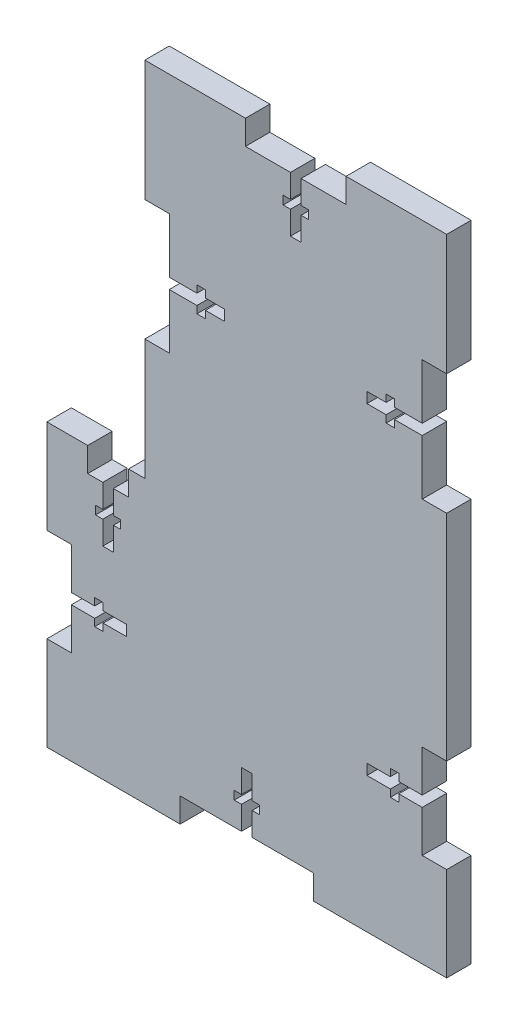
from build123d import *

# Parameters (mm, degrees)
SKETCH1_W           = 98.0948
SKETCH1_H           = 69.1388
BOSS_EXTRUDE1_DEPTH = 5.9944
SKETCH2_W           = 10.0076
SKETCH2_H           = 5.9944
CUT_EXTRUDE1_DEPTH  = 61.304425165
SKETCH3_W           = 5.9944
SKETCH3_H           = 23.046266666
CUT_EXTRUDE2_DEPTH  = 61.304425165
SKETCH4_W           = 13.5636
SKETCH4_H           = 2.6035
CUT_EXTRUDE3_DEPTH  = 61.304425165
SKETCH5_W           = 2.6035
SKETCH5_H           = 13.5636
CUT_EXTRUDE4_DEPTH  = 61.304425165
SKETCH6_W           = 6.1722
SKETCH6_H           = 2.0828
SKETCH6_W_2         = 2.0828
SKETCH6_H_2         = 6.1722
CUT_EXTRUDE5_DEPTH  = 61.304425165
SKETCH7_W           = 74.0664
SKETCH7_H           = 88.9
BOSS_EXTRUDE2_DEPTH = 5.9944
SKETCH8_W           = 32.698266666
SKETCH8_H           = 5.9944
CUT_EXTRUDE6_DEPTH  = 133.98974778
SKETCH10_W          = 2.6035
SKETCH10_H          = 13.5636
CUT_EXTRUDE7_DEPTH  = 133.98974778
SKETCH11_W          = 6.1722
SKETCH11_H          = 2.0828
CUT_EXTRUDE8_DEPTH  = 133.98974778
SKETCH12_W          = 5.9944
SKETCH12_H          = 29.633333334
CUT_EXTRUDE9_DEPTH  = 133.98974778
SKETCH13_W          = 13.5636
SKETCH13_H          = 2.6035
SKETCH13_W_2        = 2.6035
SKETCH13_H_2        = 19.558
CUT_EXTRUDE10_DEPTH = 133.98974778
SKETCH14_W          = 2.0828
SKETCH14_H          = 6.1722
SKETCH14_W_2        = 6.1722
SKETCH14_H_2        = 2.0828
CUT_EXTRUDE11_DEPTH = 133.98974778
SKETCH15_W          = 24.6888
SKETCH15_H          = 5.9944
CUT_EXTRUDE12_DEPTH = 133.98974778


with BuildPart() as part:
    # Sketch1 → Boss-Extrude1 (new body)
    with BuildSketch(Plane.XY):
        Rectangle(SKETCH1_W, SKETCH1_H)
    extrude(amount=BOSS_EXTRUDE1_DEPTH)

    # Sketch2 → Cut-Extrude1 (cut, through all)
    with BuildSketch(Plane.XY.offset(5.9944)):
        with Locations((-34.036, 31.5722)):
            Rectangle(SKETCH2_W, SKETCH2_H)
    extrude(amount=-CUT_EXTRUDE1_DEPTH, mode=Mode.SUBTRACT)

    # Sketch3 → Cut-Extrude2 (cut, through all)
    with BuildSketch(Plane.XY.offset(5.9944)):
        with Locations((-46.0502, 0)):
            Rectangle(SKETCH3_W, SKETCH3_H)
        with Locations((46.0502, 0)):
            Rectangle(SKETCH3_W, SKETCH3_H)
    extrude(amount=-CUT_EXTRUDE2_DEPTH, mode=Mode.SUBTRACT)

    # Sketch4 → Cut-Extrude3 (cut, through all)
    with BuildSketch(Plane.XY.offset(5.9944)):
        with Locations((-36.2712, 0)):
            Rectangle(SKETCH4_W, SKETCH4_H)
        with Locations((36.2712, 0)):
            Rectangle(SKETCH4_W, SKETCH4_H)
    extrude(amount=-CUT_EXTRUDE3_DEPTH, mode=Mode.SUBTRACT)

    # Sketch5 → Cut-Extrude4 (cut, through all)
    with BuildSketch(Plane.XY.offset(5.9944)):
        with Locations((-34.036, 21.7932)):
            Rectangle(SKETCH5_W, SKETCH5_H)
    extrude(amount=-CUT_EXTRUDE4_DEPTH, mode=Mode.SUBTRACT)

    # Sketch6 → Cut-Extrude5 (cut, through all)
    with BuildSketch(Plane.XY.offset(5.9944)):
        with Locations((-34.036, 21.7932)):
            Rectangle(SKETCH6_W, SKETCH6_H)
        with Locations((-36.2712, 0)):
            Rectangle(SKETCH6_W_2, SKETCH6_H_2)
        with Locations((36.2712, 0)):
            Rectangle(SKETCH6_W_2, SKETCH6_H_2)
    extrude(amount=-CUT_EXTRUDE5_DEPTH, mode=Mode.SUBTRACT)

    # Sketch7 → Boss-Extrude2 (add)
    with BuildSketch(Plane.XY.offset(5.9944)):
        with Locations((12.0142, 79.0194)):
            Rectangle(SKETCH7_W, SKETCH7_H)
    extrude(amount=-BOSS_EXTRUDE2_DEPTH)

    # Sketch8 → Cut-Extrude6 (cut, through all)
    with BuildSketch(Plane.XY.offset(5.9944)):
        with Locations((0, -31.5722)):
            Rectangle(SKETCH8_W, SKETCH8_H)
    extrude(amount=-CUT_EXTRUDE6_DEPTH, mode=Mode.SUBTRACT)

    # Sketch10 → Cut-Extrude7 (cut, through all)
    with BuildSketch(Plane.XY.offset(5.9944)):
        with Locations((0, -21.7932)):
            Rectangle(SKETCH10_W, SKETCH10_H)
    extrude(amount=-CUT_EXTRUDE7_DEPTH, mode=Mode.SUBTRACT)

    # Sketch11 → Cut-Extrude8 (cut, through all)
    with BuildSketch(Plane.XY.offset(5.9944)):
        with Locations((0, -21.7932)):
            Rectangle(SKETCH11_W, SKETCH11_H)
    extrude(amount=-CUT_EXTRUDE8_DEPTH, mode=Mode.SUBTRACT)

    # Sketch12 → Cut-Extrude9 (cut, through all)
    with BuildSketch(Plane.XY.offset(5.9944)):
        with Locations((46.0502, 79.0194)):
            Rectangle(SKETCH12_W, SKETCH12_H)
        with Locations((-22.0218, 79.0194)):
            Rectangle(SKETCH12_W, SKETCH12_H)
    extrude(amount=-CUT_EXTRUDE9_DEPTH, mode=Mode.SUBTRACT)

    # Sketch13 → Cut-Extrude10 (cut, through all)
    with BuildSketch(Plane.XY.offset(5.9944)):
        with Locations((-12.2428, 79.0194)):
            Rectangle(SKETCH13_W, SKETCH13_H)
        with Locations((36.2712, 79.0194)):
            Rectangle(SKETCH13_W, SKETCH13_H)
        with Locations((12.0142, 113.6904)):
            Rectangle(SKETCH13_W_2, SKETCH13_H_2)
    extrude(amount=-CUT_EXTRUDE10_DEPTH, mode=Mode.SUBTRACT)

    # Sketch14 → Cut-Extrude11 (cut, through all)
    with BuildSketch(Plane.XY.offset(5.9944)):
        with Locations((35.2298, 79.0194)):
            Rectangle(SKETCH14_W, SKETCH14_H)
        with Locations((-11.2014, 79.0194)):
            Rectangle(SKETCH14_W, SKETCH14_H)
        with Locations((12.0142, 110.6932)):
            Rectangle(SKETCH14_W_2, SKETCH14_H_2)
    extrude(amount=-CUT_EXTRUDE11_DEPTH, mode=Mode.SUBTRACT)

    # Sketch15 → Cut-Extrude12 (cut, through all)
    with BuildSketch(Plane.XY.offset(5.9944)):
        with Locations((12.0142, 120.4722)):
            Rectangle(SKETCH15_W, SKETCH15_H)
    extrude(amount=-CUT_EXTRUDE12_DEPTH, mode=Mode.SUBTRACT)


solid = part.part
